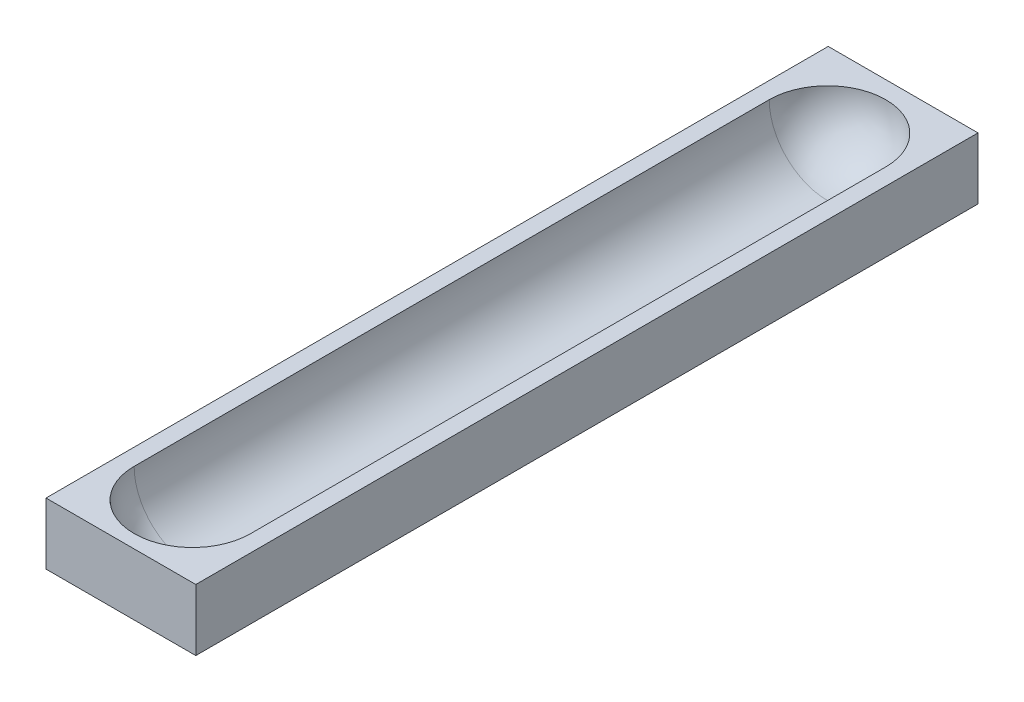
from build123d import *

# Parameters (mm, degrees)
SKETCH1_W           = 114.3
SKETCH1_H           = 596.9
BOSS_EXTRUDE1_DEPTH = 46.99
CUT_REVOLVE1_ANGLE  = 180


with BuildPart() as part:
    # Sketch1 → Boss-Extrude1 (new body)
    with BuildSketch(Plane(origin=(0, 0, 0), x_dir=(1, 0, 0), z_dir=(0, 1, 0))):
        with Locations((-57.15, 298.45)):
            Rectangle(SKETCH1_W, SKETCH1_H)
    extrude(amount=BOSS_EXTRUDE1_DEPTH)

    # Sketch2 → Cut-Revolve1 (revolve, cut)
    with BuildSketch(Plane(origin=(0, 46.99, 0), x_dir=(1, 0, 0), z_dir=(0, 1, 0))):
        with BuildLine():
            ThreePointArc((-12.7, 539.208766564), (-25.719103576, 570.639662987), (-57.15, 583.658766564))
            Line((-57.15, 583.658766564), (-57.15, 10.109470377))
            ThreePointArc((-57.15, 10.109470377), (-25.719103576, 23.128573953), (-12.7, 54.559470377))
            Line((-12.7, 54.559470377), (-12.7, 539.208766564))
        make_face()
    revolve(axis=Axis((-57.15, 46.99, -596.9), (0, 0, -1)), revolution_arc=CUT_REVOLVE1_ANGLE, mode=Mode.SUBTRACT)


solid = part.part
